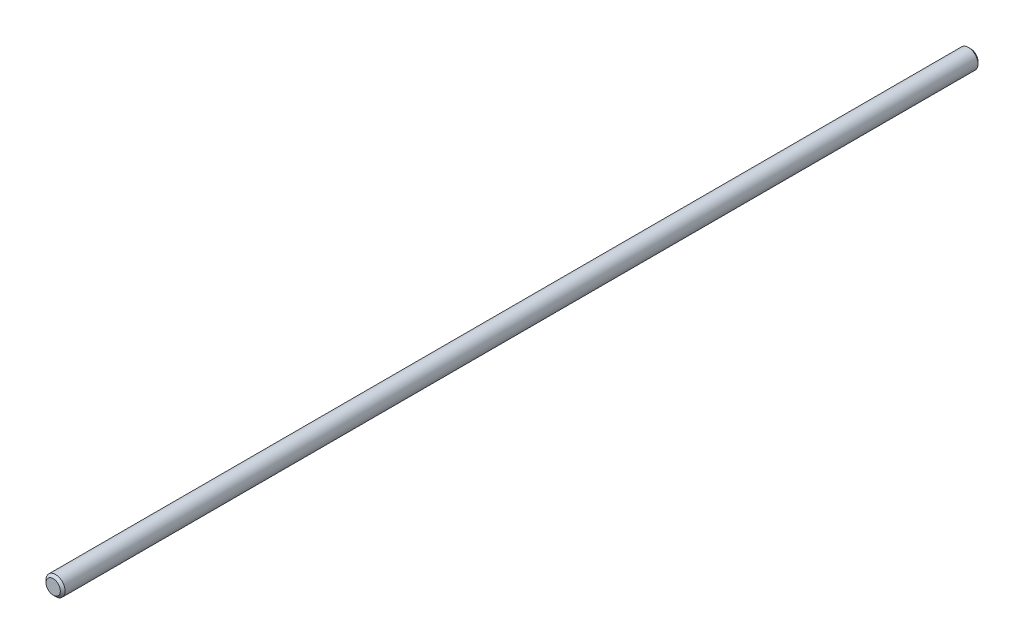
from build123d import *

# Parameters (mm, degrees)
SKETCH1_R           = 4
BOSS_EXTRUDE1_DEPTH = 384
CHAMFER1_SIZE       = 1


with BuildPart() as part:
    # Sketch1 → Boss-Extrude1 (new body)
    with BuildSketch(Plane.XY):
        Circle(SKETCH1_R)
    extrude(amount=BOSS_EXTRUDE1_DEPTH)

    # Chamfer1
    chamfer1_edges = [part.edges().sort_by_distance(p)[0] for p in [
        (-4, 0, 384),
        (-4, 0, 0),
    ]]
    chamfer(chamfer1_edges, length=CHAMFER1_SIZE)


solid = part.part
